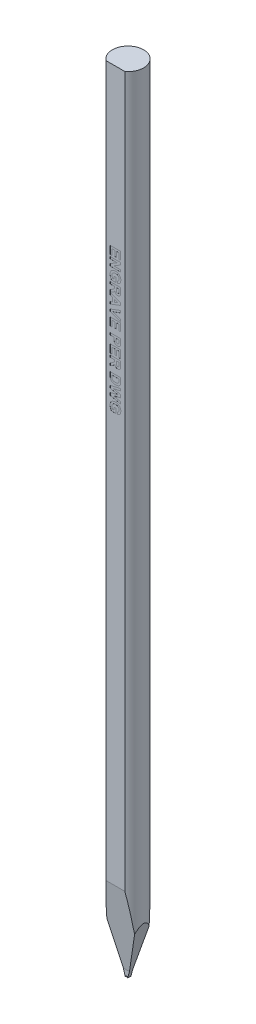
from build123d import *

# Parameters (mm, degrees)
SKETCH_TL_CUTTING_R       = 1.4986
TL_CUTTING_DEPTH          = 75.9968
SKETCH_TDF_GRINDING_W     = 3.0172
SKETCH_TDF_GRINDING_H     = 3.0172
TDF_GRINDING_DEPTH        = 77.026345527
ENGRAVING_DEPTH           = 0.005
VW_VR_GRINDING_DEPTH      = 1.5086
VW_VR_GRINDING_DEPTH_BACK = 1.5086
ISA_GRINDING_DEPTH        = 1.5086
ISA_GRINDING_DEPTH_BACK   = 1.5086
PRE_FRX_BRX_DEPTH         = 1.5086
PRE_FRX_BRX_DEPTH_BACK    = 1.5086
SKETCH_PRE_FRX_BRX_W      = 1.35874
SKETCH_PRE_FRX_BRX_H      = 0.6096
FR_EDM_R                  = 0.0381
BR_EDM_R                  = 0.0381
FA_BA_GRINDING_DEPTH      = 1.5086
FA_BA_GRINDING_DEPTH_BACK = 1.5086


with BuildPart() as part:
    # sketch_TL_cutting → TL_cutting (new body)
    with BuildSketch(Plane(origin=(0, 0, 0), x_dir=(1, 0, 0), z_dir=(0, 1, 0))):
        Circle(SKETCH_TL_CUTTING_R)
    extrude(amount=TL_CUTTING_DEPTH)

    # sketch_TDF_grinding → TDF_grinding (cut, through all)
    with BuildSketch(Plane(origin=(0, 0, 0), x_dir=(1, 0, 0), z_dir=(0, 1, 0))):
        with Locations((0, -2.71002)):
            Rectangle(SKETCH_TDF_GRINDING_W, SKETCH_TDF_GRINDING_H)
    extrude(amount=TDF_GRINDING_DEPTH, mode=Mode.SUBTRACT)

    # sketch_engraving → engraving (cut)
    # profile 1 of 13: a face of its own
    with BuildSketch(Plane.XY.offset(1.20142)):
        Polygon((-0.5, 60.894235897), (0.5, 60.894235897), (0.5, 60.150646154), (0.333333333, 60.150646154), (0.333333333, 60.701928205), (0.115384615, 60.701928205), (0.115384615, 60.189107692), (-0.051282051, 60.189107692), (-0.051282051, 60.701928205), (-0.333333333, 60.701928205), (-0.333333333, 60.137825641), (-0.5, 60.137825641), align=None)
    # profile 2 of 13: a face of its own
    with BuildSketch(Plane.XY.offset(1.20142)):
        Polygon((-0.5, 59.971158974), (0.5, 59.971158974), (0.5, 59.7702375), (-0.157451923, 59.368594872), (0.5, 59.368594872), (0.5, 59.176287179), (-0.5, 59.176287179), (-0.5, 59.38341859), (0.147035256, 59.778851282), (-0.5, 59.778851282), align=None)
    # profile 3 of 13: a face of its own
    with BuildSketch(Plane.XY.offset(1.20142)):
        with BuildLine():
            Line((-0.128205128, 58.522441026), (0.038461538, 58.522441026))
            Line((0.038461538, 58.522441026), (0.038461538, 58.08654359))
            Line((0.038461538, 58.08654359), (-0.36338141, 58.08654359))
            add(Edge.make_bspline(
                [(-0.36338141, 58.08654359), (-0.368321434, 58.092029605), (-0.378419843, 58.103244131), (-0.392661125, 58.121541895), (-0.406257259, 58.14168601), (-0.4194836, 58.1635547), (-0.432233696, 58.187193223), (-0.444685123, 58.212507295), (-0.45671611, 58.239543622), (-0.471787381, 58.277776941), (-0.488186169, 58.326991061), (-0.502445448, 58.387156306), (-0.511191227, 58.447797498), (-0.512277771, 58.488358306), (-0.512820513, 58.50861891)],
                knots=[0, 0, 0, 0, 0.581799769, 1.189316438, 1.825828404, 2.496525428, 3.203088405, 3.942228803, 4.719818701, 5.534979611, 7.181138583, 8.803804008, 10.403462225, 12, 12, 12, 12], degree=3))
            add(Edge.make_bspline(
                [(-0.512820513, 58.50861891), (-0.512629241, 58.521311396), (-0.512252188, 58.546332062), (-0.509233571, 58.583270349), (-0.504017902, 58.618987455), (-0.496780719, 58.653419967), (-0.487836372, 58.686670877), (-0.476607913, 58.718623396), (-0.463065488, 58.749243299), (-0.447986133, 58.778759812), (-0.430657849, 58.806612408), (-0.411724289, 58.832856254), (-0.390891397, 58.857236635), (-0.36853351, 58.879965448), (-0.344060025, 58.900614033), (-0.318106216, 58.919695872), (-0.290219674, 58.936754268), (-0.260879177, 58.95208079), (-0.230317098, 58.965710173), (-0.198781008, 58.977212477), (-0.166726875, 58.987296153), (-0.134042675, 58.995583938), (-0.10062201, 59.001670885), (-0.066619552, 59.00640276), (-0.031822841, 59.008944234), (-0.008417054, 59.009393556), (0.003405449, 59.009620513)],
                knots=[0, 0, 0, 0, 1.124897971, 2.217508473, 3.282174662, 4.322209414, 5.334422951, 6.332119154, 7.320662553, 8.300074908, 9.267468154, 10.225199689, 11.165658754, 12.107290334, 13.047749399, 14.00069605, 14.959944213, 15.942088746, 16.933021067, 17.923599838, 18.915715637, 19.910475908, 20.909926025, 21.925232038, 22.952013513, 24, 24, 24, 24], degree=3))
            add(Edge.make_bspline(
                [(0.003405449, 59.009620513), (0.016165747, 59.009436614), (0.041321811, 59.009074069), (0.078501182, 59.005944425), (0.114594914, 59.00109647), (0.149519517, 58.993701478), (0.183523729, 58.984848027), (0.216299841, 58.973503339), (0.248180515, 58.960549892), (0.278688999, 58.945265774), (0.308028284, 58.928383202), (0.335510174, 58.909199631), (0.361403632, 58.88838003), (0.385591047, 58.865737199), (0.407627145, 58.840898237), (0.428063784, 58.814372539), (0.447146094, 58.78617769), (0.457908016, 58.766000967), (0.463341346, 58.755814423)],
                knots=[0, 0, 0, 0, 1.105132952, 2.178694671, 3.229818344, 4.257558797, 5.269123684, 6.27148554, 7.259679084, 8.247804916, 9.224967877, 10.189258471, 11.147685264, 12.101072275, 13.055511435, 14.02039165, 15.000562851, 16, 16, 16, 16], degree=3))
            add(Edge.make_bspline(
                [(0.463341346, 58.755814423), (0.467347168, 58.747727072), (0.475455657, 58.731356849), (0.485329628, 58.705283756), (0.494054347, 58.677916179), (0.500719187, 58.648934703), (0.506115234, 58.618648224), (0.510216979, 58.586907147), (0.512307439, 58.553652939), (0.512647258, 58.530990515), (0.512820513, 58.519436218)],
                knots=[0, 0, 0, 0, 0.887950456, 1.797368171, 2.741221183, 3.713797788, 4.722103116, 5.768966405, 6.862521341, 8, 8, 8, 8], degree=3))
            add(Edge.make_bspline(
                [(0.512820513, 58.519436218), (0.512598613, 58.504538718), (0.512167059, 58.475565835), (0.508571106, 58.433325541), (0.502373597, 58.393571904), (0.493837942, 58.356249565), (0.482863355, 58.321438928), (0.469371425, 58.289199918), (0.453633675, 58.25933466), (0.435019378, 58.232275716), (0.414494937, 58.207473149), (0.392035387, 58.18499168), (0.367607461, 58.164822262), (0.341334074, 58.146951549), (0.313106625, 58.131520198), (0.283182558, 58.118252182), (0.251334696, 58.107331), (0.22921692, 58.102053034), (0.217948718, 58.099364103)],
                knots=[0, 0, 0, 0, 1.271135529, 2.472123572, 3.614091059, 4.701890498, 5.736279567, 6.724681829, 7.680621489, 8.611506429, 9.52200816, 10.424540711, 11.318996785, 12.221421405, 13.131851814, 14.060431888, 15.011860567, 16, 16, 16, 16], degree=3))
            Line((0.217948718, 58.099364103), (0.179487179, 58.291671795))
            add(Edge.make_bspline(
                [(0.179487179, 58.291671795), (0.185798707, 58.293574377), (0.198251232, 58.297328136), (0.216108293, 58.304634712), (0.232994438, 58.312952834), (0.248643132, 58.322779827), (0.263649233, 58.333217482), (0.277161531, 58.345487665), (0.290187329, 58.358394684), (0.301701762, 58.37288584), (0.312086782, 58.388324395), (0.321450083, 58.404545863), (0.329043783, 58.421914205), (0.335153652, 58.440186828), (0.340342569, 58.459274233), (0.343533767, 58.479425571), (0.345940549, 58.50041453), (0.346081986, 58.514754556), (0.346153846, 58.522040385)],
                knots=[0, 0, 0, 0, 1.027780279, 2.027791312, 3.006028774, 3.96000864, 4.908113241, 5.852721087, 6.802883308, 7.765918715, 8.733730415, 9.704005314, 10.683351261, 11.68471758, 12.707948499, 13.764514378, 14.864202456, 16, 16, 16, 16], degree=3))
            add(Edge.make_bspline(
                [(0.346153846, 58.522040385), (0.345859633, 58.533067741), (0.34528545, 58.554588568), (0.341538784, 58.586006107), (0.334873123, 58.615645672), (0.325679114, 58.64358477), (0.313877959, 58.669874621), (0.299029501, 58.694159968), (0.282012344, 58.717045501), (0.262039987, 58.737879978), (0.239645267, 58.756774481), (0.214561065, 58.773131053), (0.186868462, 58.78674783), (0.156706511, 58.797900746), (0.124073954, 58.806780847), (0.088855272, 58.812804995), (0.051104495, 58.816741063), (0.02505068, 58.817118323), (0.01161859, 58.817312821)],
                knots=[0, 0, 0, 0, 1.043810997, 2.037086103, 2.989314757, 3.91471467, 4.817033861, 5.710208705, 6.603920097, 7.511448416, 8.435617211, 9.371747005, 10.338444094, 11.350425613, 12.411431869, 13.5347293, 14.729025275, 16, 16, 16, 16], degree=3))
            add(Edge.make_bspline(
                [(0.01161859, 58.817312821), (-0.002813331, 58.817110147), (-0.03086261, 58.816716238), (-0.071503034, 58.812881337), (-0.109371212, 58.806583116), (-0.14440027, 58.797515757), (-0.176807311, 58.786208494), (-0.206438048, 58.772228966), (-0.233109204, 58.75542113), (-0.256980675, 58.736358295), (-0.278169336, 58.715321484), (-0.296147735, 58.692258524), (-0.31184176, 58.668000317), (-0.32420794, 58.641860517), (-0.33413508, 58.614312028), (-0.341078682, 58.585085999), (-0.345395871, 58.554287729), (-0.345897627, 58.533206176), (-0.346153846, 58.522441026)],
                knots=[0, 0, 0, 0, 1.31821493, 2.562027667, 3.72541598, 4.821825939, 5.863743127, 6.857000185, 7.808227391, 8.737146514, 9.643023621, 10.529087527, 11.404035307, 12.277173472, 13.164790074, 14.074766194, 15.016892606, 16, 16, 16, 16], degree=3))
            add(Edge.make_bspline(
                [(-0.346153846, 58.522441026), (-0.345850315, 58.511537735), (-0.34524035, 58.489626847), (-0.340086045, 58.456805767), (-0.332449955, 58.423805514), (-0.321065283, 58.391413163), (-0.307937779, 58.360026456), (-0.292687307, 58.330860255), (-0.276962331, 58.303467677), (-0.264654274, 58.2869552), (-0.258613782, 58.278851282)],
                knots=[0, 0, 0, 0, 0.993779204, 1.997065276, 3.023588959, 4.078879359, 5.123947549, 6.123456565, 7.079038607, 8, 8, 8, 8], degree=3))
            Line((-0.258613782, 58.278851282), (-0.128205128, 58.278851282))
            Line((-0.128205128, 58.278851282), (-0.128205128, 58.522441026))
        make_face()
    # profile 4 of 13: a face of its own
    with BuildSketch(Plane.XY.offset(1.20142)):
        with BuildLine():
            Line((-0.5, 57.894235897), (0.5, 57.894235897))
            Line((0.5, 57.894235897), (0.5, 57.474564423))
            add(Edge.make_bspline(
                [(0.5, 57.474564423), (0.499921351, 57.461810201), (0.499769781, 57.437230481), (0.498665723, 57.401683268), (0.496349389, 57.368901265), (0.493735057, 57.338736822), (0.489890849, 57.311277094), (0.485377151, 57.286456079), (0.480042652, 57.264353829), (0.473762142, 57.2447266), (0.46640441, 57.226899938), (0.457825047, 57.210235326), (0.447696774, 57.194575272), (0.436444977, 57.179714477), (0.424039539, 57.165595254), (0.410155618, 57.152603274), (0.394999014, 57.140512567), (0.378696089, 57.129332781), (0.361318758, 57.119484096), (0.343425117, 57.110484982), (0.324824746, 57.103159364), (0.305605269, 57.09710847), (0.285808412, 57.092274923), (0.265383845, 57.088920032), (0.244368538, 57.086825611), (0.230173307, 57.086638641), (0.222956731, 57.08654359)],
                knots=[0, 0, 0, 0, 1.675792322, 3.229558513, 4.671612708, 5.993327294, 7.206773438, 8.313218507, 9.306927966, 10.191988363, 11.018030861, 11.838135071, 12.650980327, 13.465150207, 14.285535933, 15.117196726, 15.959844754, 16.83101188, 17.711363548, 18.582398133, 19.460517458, 20.334551361, 21.228266118, 22.135486512, 23.052118027, 24, 24, 24, 24], degree=3))
            add(Edge.make_bspline(
                [(0.222956731, 57.08654359), (0.213865176, 57.08671771), (0.196097772, 57.087057988), (0.170067915, 57.090259374), (0.145135532, 57.094860931), (0.121515047, 57.101974247), (0.099028777, 57.110818829), (0.077834712, 57.121624821), (0.057734109, 57.134377691), (0.039011166, 57.149143067), (0.021628172, 57.165861702), (0.005964946, 57.184627919), (-0.008142217, 57.205317705), (-0.020271369, 57.228100383), (-0.030960543, 57.252583224), (-0.039742833, 57.279088699), (-0.046961528, 57.30748005), (-0.050349413, 57.327234525), (-0.052083333, 57.337344872)],
                knots=[0, 0, 0, 0, 1.059179627, 2.069928931, 3.052909591, 4.01082991, 4.940120368, 5.865982481, 6.779263376, 7.710344595, 8.640547144, 9.585223395, 10.554458868, 11.553878165, 12.589111246, 13.664634927, 14.804759383, 16, 16, 16, 16], degree=3))
            add(Edge.make_bspline(
                [(-0.052083333, 57.337344872), (-0.058543192, 57.327554557), (-0.071157156, 57.308437315), (-0.092244136, 57.282140986), (-0.113935974, 57.258182324), (-0.13350323, 57.240195798), (-0.150629326, 57.226361316), (-0.165615492, 57.215228495), (-0.182859981, 57.203217912), (-0.202374991, 57.19044991), (-0.22398696, 57.176546224), (-0.248026974, 57.162024206), (-0.274260457, 57.146579885), (-0.292585876, 57.136196031), (-0.302083333, 57.130814423)],
                knots=[0, 0, 0, 0, 1.285482994, 2.510122655, 3.691653098, 4.826411195, 5.419869803, 6.105175889, 6.872935239, 7.723789235, 8.662129684, 9.690525463, 10.803075916, 12, 12, 12, 12], degree=3))
            Line((-0.302083333, 57.130814423), (-0.5, 57.009620513))
            Line((-0.5, 57.009620513), (-0.5, 57.234380128))
            Line((-0.5, 57.234380128), (-0.273036859, 57.376607692))
            add(Edge.make_bspline(
                [(-0.273036859, 57.376607692), (-0.263945443, 57.383137401), (-0.24658806, 57.395603957), (-0.221949287, 57.41363509), (-0.199893124, 57.430036608), (-0.1805544, 57.444827372), (-0.163731826, 57.457827709), (-0.149845803, 57.469482343), (-0.138230202, 57.479219639), (-0.126725879, 57.490254127), (-0.114887633, 57.503080533), (-0.103494307, 57.518942305), (-0.094238036, 57.535123543), (-0.087286311, 57.55262809), (-0.082478883, 57.572919627), (-0.079343719, 57.597279092), (-0.077067211, 57.626432144), (-0.076973557, 57.647502303), (-0.076923077, 57.658859295)],
                knots=[0, 0, 0, 0, 1.465382114, 2.797715724, 3.99708711, 5.063614826, 5.985194575, 6.779875669, 7.43696127, 7.968700361, 8.866038685, 9.717629234, 10.520014012, 11.30082289, 12.174340694, 13.242479345, 14.513673363, 16, 16, 16, 16], degree=3))
            Line((-0.076923077, 57.658859295), (-0.076923077, 57.701928205))
            Line((-0.076923077, 57.701928205), (-0.5, 57.701928205))
            Line((-0.5, 57.701928205), (-0.5, 57.894235897))
        make_face()
        with BuildLine():
            Line((0.08974359, 57.701928205), (0.08974359, 57.547080449))
            add(Edge.make_bspline(
                [(0.08974359, 57.547080449), (0.089768957, 57.5351274), (0.089817287, 57.512354821), (0.090527354, 57.479971991), (0.091115821, 57.451109113), (0.09265079, 57.425809153), (0.094114881, 57.404019334), (0.096069001, 57.385767128), (0.09836301, 57.371028848), (0.101931469, 57.356307986), (0.108148092, 57.341228202), (0.117003495, 57.325158518), (0.128487921, 57.311415466), (0.141777239, 57.299542986), (0.157332372, 57.290378485), (0.174706183, 57.283657484), (0.193862841, 57.279643774), (0.20724563, 57.279120802), (0.214142628, 57.278851282)],
                knots=[0, 0, 0, 0, 1.698120923, 3.235207303, 4.601799022, 5.7989489, 6.835765357, 7.704239165, 8.40605236, 8.953649664, 9.852072573, 10.714567413, 11.550246753, 12.383769498, 13.234656382, 14.099651817, 15.020630301, 16, 16, 16, 16], degree=3))
            add(Edge.make_bspline(
                [(0.214142628, 57.278851282), (0.221852989, 57.27918604), (0.236728888, 57.2798319), (0.257822961, 57.285086949), (0.27662771, 57.293834428), (0.292813882, 57.306323618), (0.306623576, 57.32192236), (0.317392842, 57.340646681), (0.325576055, 57.362091747), (0.328565774, 57.377545804), (0.330128205, 57.385622115)],
                knots=[0, 0, 0, 0, 1.062451802, 2.049829439, 2.976851779, 3.903462222, 4.849641532, 5.832195941, 6.867102576, 8, 8, 8, 8], degree=3))
            add(Edge.make_bspline(
                [(0.330128205, 57.385622115), (0.330421459, 57.388291011), (0.331116534, 57.394616853), (0.331562949, 57.405787541), (0.332249138, 57.420070698), (0.332529569, 57.437639208), (0.333021138, 57.458336115), (0.333111403, 57.482243719), (0.333399792, 57.509286063), (0.333356297, 57.528383752), (0.333333333, 57.538466667)],
                knots=[0, 0, 0, 0, 0.42127143, 0.998501726, 1.753681744, 2.66564073, 3.755712164, 5.002818897, 6.417592707, 8, 8, 8, 8], degree=3))
            Line((0.333333333, 57.538466667), (0.333333333, 57.701928205))
            Line((0.333333333, 57.701928205), (0.08974359, 57.701928205))
        make_face(mode=Mode.SUBTRACT)
    # profile 5 of 13: a face of its own
    with BuildSketch(Plane.XY.offset(1.20142)):
        Polygon((-0.5, 56.035261538), (-0.5, 56.239187821), (-0.269230769, 56.323522756), (-0.269230769, 56.707336859), (-0.5, 56.791671795), (-0.5, 56.9968), (0.5, 56.618795192), (0.5, 56.415069231), align=None)
        Polygon((-0.102564103, 56.384620513), (0.256410256, 56.516030769), (-0.102564103, 56.647040385), align=None, mode=Mode.SUBTRACT)
    # profile 6 of 13: a face of its own
    with BuildSketch(Plane.XY.offset(1.20142)):
        Polygon((-0.5, 55.627008333), (0.5, 55.9968), (0.5, 55.793675), (-0.243589744, 55.528851282), (0.5, 55.265029167), (0.5, 55.060902564), (-0.5, 55.429291987), align=None)
    # profile 7 of 13: a face of its own
    with BuildSketch(Plane.XY.offset(1.20142)):
        Polygon((-0.5, 54.971158974), (0.5, 54.971158974), (0.5, 54.227569231), (0.333333333, 54.227569231), (0.333333333, 54.778851282), (0.115384615, 54.778851282), (0.115384615, 54.266030769), (-0.051282051, 54.266030769), (-0.051282051, 54.778851282), (-0.333333333, 54.778851282), (-0.333333333, 54.214748718), (-0.5, 54.214748718), align=None)
    # profile 8 of 13: a face of its own
    with BuildSketch(Plane.XY.offset(1.20142)):
        with BuildLine():
            Line((-0.5, 53.663466667), (0.5, 53.663466667))
            Line((0.5, 53.663466667), (0.5, 53.343554808))
            add(Edge.make_bspline(
                [(0.5, 53.343554808), (0.4999852, 53.329064455), (0.499956962, 53.301416693), (0.499104777, 53.261884062), (0.497929464, 53.226289855), (0.496434625, 53.194622803), (0.494248137, 53.166966334), (0.491629455, 53.143258956), (0.488933209, 53.123391744), (0.486060508, 53.111634128), (0.484775641, 53.106375321)],
                knots=[0, 0, 0, 0, 1.460492613, 2.786636817, 3.985312262, 5.05006335, 5.98179196, 6.7807735, 7.454678796, 8, 8, 8, 8], degree=3))
            add(Edge.make_bspline(
                [(0.484775641, 53.106375321), (0.482781564, 53.099381959), (0.478823789, 53.085501776), (0.470386441, 53.065615803), (0.460608006, 53.04644887), (0.448953875, 53.028241805), (0.435630967, 53.010932663), (0.420747869, 52.994470188), (0.404237636, 52.978765844), (0.386131953, 52.964039765), (0.366525691, 52.950543742), (0.345376234, 52.938912401), (0.322847402, 52.929051925), (0.298873329, 52.921127517), (0.273610941, 52.914575617), (0.246834559, 52.910393024), (0.218752408, 52.907369504), (0.199528035, 52.9071623), (0.189703526, 52.90705641)],
                knots=[0, 0, 0, 0, 0.907183394, 1.800546498, 2.691728384, 3.591410291, 4.495216108, 5.416087871, 6.359626967, 7.337496937, 8.327236581, 9.327316132, 10.346534403, 11.393207653, 12.477041209, 13.600953845, 14.773980723, 16, 16, 16, 16], degree=3))
            add(Edge.make_bspline(
                [(0.189703526, 52.90705641), (0.174784734, 52.907364918), (0.146065241, 52.907958813), (0.104894137, 52.914608263), (0.067280604, 52.924741168), (0.03361575, 52.939582122), (0.003633111, 52.957595209), (-0.023091697, 52.977763014), (-0.046492635, 53.000246245), (-0.066210989, 53.024825478), (-0.082434, 53.050756803), (-0.096247437, 53.076755341), (-0.106871469, 53.103146515), (-0.11149992, 53.12114078), (-0.113782051, 53.130013141)],
                knots=[0, 0, 0, 0, 1.312446177, 2.526530956, 3.662051072, 4.733637382, 5.754065268, 6.735959421, 7.675686778, 8.604015004, 9.502732733, 10.365317746, 11.193993632, 12, 12, 12, 12], degree=3))
            add(Edge.make_bspline(
                [(-0.113782051, 53.130013141), (-0.114986663, 53.136345752), (-0.11752584, 53.149694139), (-0.120056937, 53.170863883), (-0.122858586, 53.194003561), (-0.124685978, 53.219208347), (-0.126397255, 53.24644775), (-0.127205205, 53.275711194), (-0.128178621, 53.306956857), (-0.128196112, 53.328463031), (-0.128205128, 53.339548397)],
                knots=[0, 0, 0, 0, 0.735353946, 1.55003838, 2.431865514, 3.394945452, 4.432993119, 5.54609699, 6.735134699, 8, 8, 8, 8], degree=3))
            Line((-0.128205128, 53.339548397), (-0.128205128, 53.471158974))
            Line((-0.128205128, 53.471158974), (-0.5, 53.471158974))
            Line((-0.5, 53.471158974), (-0.5, 53.663466667))
        make_face()
        with BuildLine():
            Line((0.333333333, 53.471158974), (0.038461538, 53.471158974))
            Line((0.038461538, 53.471158974), (0.038461538, 53.355774359))
            add(Edge.make_bspline(
                [(0.038461538, 53.355774359), (0.038474423, 53.345824233), (0.038499073, 53.32678839), (0.039383856, 53.299476178), (0.040463899, 53.274753138), (0.04225159, 53.252567611), (0.044607724, 53.233053517), (0.047425958, 53.216080173), (0.050450217, 53.201627797), (0.055461898, 53.18599952), (0.063570342, 53.169289767), (0.075224213, 53.151445715), (0.089157789, 53.135769737), (0.105522293, 53.122725245), (0.123704204, 53.112305583), (0.143517189, 53.104845099), (0.164632877, 53.10002787), (0.179260262, 53.099587861), (0.186698718, 53.099364103)],
                knots=[0, 0, 0, 0, 1.411705958, 2.700771114, 3.876961699, 4.922619712, 5.858038221, 6.66485904, 7.363650596, 7.950905807, 8.989198271, 9.987739806, 10.967313358, 11.951275539, 12.944273208, 13.927870418, 14.946261014, 16, 16, 16, 16], degree=3))
            add(Edge.make_bspline(
                [(0.186698718, 53.099364103), (0.195758642, 53.099679017), (0.213324639, 53.100289596), (0.238341551, 53.10702257), (0.261044702, 53.117410781), (0.280727694, 53.132262972), (0.297279472, 53.15020407), (0.31105114, 53.170369116), (0.320688658, 53.193188742), (0.32442284, 53.209338921), (0.326322115, 53.217553205)],
                knots=[0, 0, 0, 0, 1.085904563, 2.105425768, 3.088705091, 4.068969419, 5.045188284, 6.010769642, 6.988240112, 8, 8, 8, 8], degree=3))
            add(Edge.make_bspline(
                [(0.326322115, 53.217553205), (0.326887477, 53.221087999), (0.328142404, 53.228934146), (0.329452077, 53.241976039), (0.330643223, 53.257404601), (0.331621189, 53.275238428), (0.332385732, 53.295406833), (0.333055661, 53.31797634), (0.333109481, 53.342887507), (0.333256648, 53.36031512), (0.333333333, 53.369396154)],
                knots=[0, 0, 0, 0, 0.564603001, 1.253243608, 2.066786758, 3.005752288, 4.070476343, 5.250658742, 6.567396469, 8, 8, 8, 8], degree=3))
            Line((0.333333333, 53.369396154), (0.333333333, 53.471158974))
        make_face(mode=Mode.SUBTRACT)
    # profile 9 of 13: a face of its own
    with BuildSketch(Plane.XY.offset(1.20142)):
        Polygon((-0.5, 52.740389744), (0.5, 52.740389744), (0.5, 51.9968), (0.333333333, 51.9968), (0.333333333, 52.548082051), (0.115384615, 52.548082051), (0.115384615, 52.035261538), (-0.051282051, 52.035261538), (-0.051282051, 52.548082051), (-0.333333333, 52.548082051), (-0.333333333, 51.983979487), (-0.5, 51.983979487), align=None)
    # profile 10 of 13: a face of its own
    with BuildSketch(Plane.XY.offset(1.20142)):
        with BuildLine():
            Line((-0.5, 51.817312821), (0.5, 51.817312821))
            Line((0.5, 51.817312821), (0.5, 51.397641346))
            add(Edge.make_bspline(
                [(0.5, 51.397641346), (0.499921351, 51.384887124), (0.499769781, 51.360307404), (0.498665723, 51.324760191), (0.496349389, 51.291978188), (0.493735057, 51.261813745), (0.489890849, 51.234354017), (0.485377151, 51.209533002), (0.480042652, 51.187430752), (0.473762142, 51.167803523), (0.46640441, 51.149976861), (0.457825047, 51.133312249), (0.447696774, 51.117652195), (0.436444977, 51.1027914), (0.424039539, 51.088672178), (0.410155618, 51.075680198), (0.394999014, 51.06358949), (0.378696089, 51.052409704), (0.361318758, 51.042561019), (0.343425117, 51.033561905), (0.324824746, 51.026236287), (0.305605269, 51.020185393), (0.285808412, 51.015351846), (0.265383845, 51.011996956), (0.244368538, 51.009902534), (0.230173307, 51.009715564), (0.222956731, 51.009620513)],
                knots=[0, 0, 0, 0, 1.675792322, 3.229558513, 4.671612708, 5.993327294, 7.206773438, 8.313218507, 9.306927966, 10.191988363, 11.018030861, 11.838135071, 12.650980327, 13.465150207, 14.285535933, 15.117196726, 15.959844754, 16.83101188, 17.711363548, 18.582398133, 19.460517458, 20.334551361, 21.228266118, 22.135486512, 23.052118027, 24, 24, 24, 24], degree=3))
            add(Edge.make_bspline(
                [(0.222956731, 51.009620513), (0.213865176, 51.009794633), (0.196097772, 51.010134911), (0.170067915, 51.013336297), (0.145135532, 51.017937854), (0.121515047, 51.02505117), (0.099028777, 51.033895752), (0.077834712, 51.044701744), (0.057734109, 51.057454614), (0.039011166, 51.07221999), (0.021628172, 51.088938625), (0.005964946, 51.107704843), (-0.008142217, 51.128394628), (-0.020271369, 51.151177306), (-0.030960543, 51.175660147), (-0.039742833, 51.202165622), (-0.046961528, 51.230556973), (-0.050349413, 51.250311448), (-0.052083333, 51.260421795)],
                knots=[0, 0, 0, 0, 1.059179627, 2.069928931, 3.052909591, 4.01082991, 4.940120368, 5.865982481, 6.779263376, 7.710344595, 8.640547144, 9.585223395, 10.554458868, 11.553878165, 12.589111246, 13.664634927, 14.804759383, 16, 16, 16, 16], degree=3))
            add(Edge.make_bspline(
                [(-0.052083333, 51.260421795), (-0.058543192, 51.25063148), (-0.071157156, 51.231514238), (-0.092244136, 51.205217909), (-0.113935974, 51.181259247), (-0.13350323, 51.163272722), (-0.150629326, 51.149438239), (-0.165615492, 51.138305418), (-0.182859981, 51.126294835), (-0.202374991, 51.113526833), (-0.22398696, 51.099623147), (-0.248026974, 51.085101129), (-0.274260457, 51.069656808), (-0.292585876, 51.059272954), (-0.302083333, 51.053891346)],
                knots=[0, 0, 0, 0, 1.285482994, 2.510122655, 3.691653098, 4.826411195, 5.419869803, 6.105175889, 6.872935239, 7.723789235, 8.662129684, 9.690525463, 10.803075916, 12, 12, 12, 12], degree=3))
            Line((-0.302083333, 51.053891346), (-0.5, 50.932697436))
            Line((-0.5, 50.932697436), (-0.5, 51.157457051))
            Line((-0.5, 51.157457051), (-0.273036859, 51.299684615))
            add(Edge.make_bspline(
                [(-0.273036859, 51.299684615), (-0.263945443, 51.306214324), (-0.24658806, 51.31868088), (-0.221949287, 51.336712013), (-0.199893124, 51.353113531), (-0.1805544, 51.367904295), (-0.163731826, 51.380904632), (-0.149845803, 51.392559266), (-0.138230202, 51.402296562), (-0.126725879, 51.41333105), (-0.114887633, 51.426157456), (-0.103494307, 51.442019228), (-0.094238036, 51.458200466), (-0.087286311, 51.475705013), (-0.082478883, 51.495996551), (-0.079343719, 51.520356015), (-0.077067211, 51.549509067), (-0.076973557, 51.570579226), (-0.076923077, 51.581936218)],
                knots=[0, 0, 0, 0, 1.465382114, 2.797715724, 3.99708711, 5.063614826, 5.985194575, 6.779875669, 7.43696127, 7.968700361, 8.866038685, 9.717629234, 10.520014012, 11.30082289, 12.174340694, 13.242479345, 14.513673363, 16, 16, 16, 16], degree=3))
            Line((-0.076923077, 51.581936218), (-0.076923077, 51.625005128))
            Line((-0.076923077, 51.625005128), (-0.5, 51.625005128))
            Line((-0.5, 51.625005128), (-0.5, 51.817312821))
        make_face()
        with BuildLine():
            Line((0.08974359, 51.625005128), (0.08974359, 51.470157372))
            add(Edge.make_bspline(
                [(0.08974359, 51.470157372), (0.089768957, 51.458204323), (0.089817287, 51.435431744), (0.090527354, 51.403048914), (0.091115821, 51.374186036), (0.09265079, 51.348886076), (0.094114881, 51.327096257), (0.096069001, 51.308844051), (0.09836301, 51.294105771), (0.101931469, 51.279384909), (0.108148092, 51.264305125), (0.117003495, 51.248235441), (0.128487921, 51.234492389), (0.141777239, 51.222619909), (0.157332372, 51.213455408), (0.174706183, 51.206734407), (0.193862841, 51.202720697), (0.20724563, 51.202197726), (0.214142628, 51.201928205)],
                knots=[0, 0, 0, 0, 1.698120923, 3.235207303, 4.601799022, 5.7989489, 6.835765357, 7.704239165, 8.40605236, 8.953649664, 9.852072573, 10.714567413, 11.550246753, 12.383769498, 13.234656382, 14.099651817, 15.020630301, 16, 16, 16, 16], degree=3))
            add(Edge.make_bspline(
                [(0.214142628, 51.201928205), (0.221852989, 51.202262963), (0.236728888, 51.202908823), (0.257822961, 51.208163872), (0.27662771, 51.216911351), (0.292813882, 51.229400541), (0.306623576, 51.244999283), (0.317392842, 51.263723604), (0.325576055, 51.28516867), (0.328565774, 51.300622727), (0.330128205, 51.308699038)],
                knots=[0, 0, 0, 0, 1.062451802, 2.049829439, 2.976851779, 3.903462222, 4.849641532, 5.832195941, 6.867102576, 8, 8, 8, 8], degree=3))
            add(Edge.make_bspline(
                [(0.330128205, 51.308699038), (0.330421459, 51.311367934), (0.331116534, 51.317693776), (0.331562949, 51.328864464), (0.332249138, 51.343147621), (0.332529569, 51.360716131), (0.333021138, 51.381413038), (0.333111403, 51.405320642), (0.333399792, 51.432362986), (0.333356297, 51.451460675), (0.333333333, 51.46154359)],
                knots=[0, 0, 0, 0, 0.42127143, 0.998501726, 1.753681744, 2.66564073, 3.755712164, 5.002818897, 6.417592707, 8, 8, 8, 8], degree=3))
            Line((0.333333333, 51.46154359), (0.333333333, 51.625005128))
            Line((0.333333333, 51.625005128), (0.08974359, 51.625005128))
        make_face(mode=Mode.SUBTRACT)
    # profile 11 of 13: a face of its own
    with BuildSketch(Plane.XY.offset(1.20142)):
        with BuildLine():
            Line((0.5, 50.432697436), (0.5, 50.065910577))
            add(Edge.make_bspline(
                [(0.5, 50.065910577), (0.500005193, 50.055893032), (0.500015306, 50.036386546), (0.498840892, 50.008077527), (0.497659587, 49.981604956), (0.495294873, 49.957044813), (0.492816233, 49.934311894), (0.489678088, 49.913365404), (0.485656212, 49.894337663), (0.482484481, 49.882338781), (0.480969551, 49.876607692)],
                knots=[0, 0, 0, 0, 1.259756885, 2.453039283, 3.563158368, 4.591894114, 5.55549294, 6.43918076, 7.254497783, 8, 8, 8, 8], degree=3))
            add(Edge.make_bspline(
                [(0.480969551, 49.876607692), (0.478637325, 49.869438716), (0.474014881, 49.855229893), (0.465827813, 49.83437684), (0.455960096, 49.814542941), (0.445111978, 49.79526828), (0.432903728, 49.776996015), (0.419595761, 49.759281335), (0.404753223, 49.742648264), (0.383633179, 49.721113601), (0.35420815, 49.696688717), (0.315375005, 49.670858181), (0.272594656, 49.649120476), (0.234409605, 49.633929103), (0.20183843, 49.623885004), (0.175754603, 49.617316602), (0.148301213, 49.611644929), (0.119383738, 49.607394754), (0.08913491, 49.603733367), (0.057465542, 49.601105699), (0.024383276, 49.599804712), (0.001870575, 49.599512956), (-0.009615385, 49.599364103)],
                knots=[0, 0, 0, 0, 0.745431882, 1.477436776, 2.212739876, 2.934276521, 3.663147754, 4.384200836, 5.123377481, 5.865761747, 7.365547505, 8.894711587, 10.468722596, 12.101948761, 12.951987285, 13.837595333, 14.760899389, 15.722756883, 16.726861385, 17.773652936, 18.864119771, 20, 20, 20, 20], degree=3))
            add(Edge.make_bspline(
                [(-0.009615385, 49.599364103), (-0.0294616, 49.599755507), (-0.067834928, 49.600512302), (-0.123301552, 49.606109673), (-0.17465514, 49.61540511), (-0.206804138, 49.625115536), (-0.222355769, 49.629812821)],
                knots=[0, 0, 0, 0, 1.103491527, 2.133638164, 3.0971734, 4, 4, 4, 4], degree=3))
            add(Edge.make_bspline(
                [(-0.222355769, 49.629812821), (-0.231274521, 49.632986465), (-0.248819098, 49.639229518), (-0.274127236, 49.650154394), (-0.298211673, 49.661958799), (-0.321053432, 49.674740646), (-0.342549771, 49.688564513), (-0.362636394, 49.703482107), (-0.381577746, 49.719262192), (-0.393236239, 49.730693951), (-0.399038462, 49.736383333)],
                knots=[0, 0, 0, 0, 1.090884612, 2.145940218, 3.175104604, 4.181306866, 5.161203701, 6.118658341, 7.063689906, 8, 8, 8, 8], degree=3))
            add(Edge.make_bspline(
                [(-0.399038462, 49.736383333), (-0.407300305, 49.745669607), (-0.424264154, 49.764736893), (-0.445652736, 49.798088411), (-0.464086504, 49.835963738), (-0.473760833, 49.863277629), (-0.478766026, 49.877408974)],
                knots=[0, 0, 0, 0, 0.912008655, 1.872605891, 2.89935344, 4, 4, 4, 4], degree=3))
            add(Edge.make_bspline(
                [(-0.478766026, 49.877408974), (-0.4805228, 49.883128948), (-0.484168894, 49.895000457), (-0.488062998, 49.913823906), (-0.492165475, 49.933918409), (-0.49463687, 49.955515685), (-0.497243066, 49.978391543), (-0.498706299, 50.002728283), (-0.49974511, 50.028441542), (-0.499913777, 50.046077636), (-0.5, 50.055093269)],
                knots=[0, 0, 0, 0, 0.799129865, 1.658552685, 2.566799617, 3.538529252, 4.561352959, 5.643373779, 6.795284424, 8, 8, 8, 8], degree=3))
            Line((-0.5, 50.055093269), (-0.5, 50.432697436))
            Line((-0.5, 50.432697436), (0.5, 50.432697436))
        make_face()
        with BuildLine():
            Line((0.333333333, 50.240389744), (-0.333333333, 50.240389744))
            Line((-0.333333333, 50.240389744), (-0.333333333, 50.082136538))
            add(Edge.make_bspline(
                [(-0.333333333, 50.082136538), (-0.333276671, 50.074991821), (-0.333167574, 50.061235511), (-0.332847006, 50.041329778), (-0.331979167, 50.023036576), (-0.331080228, 50.006260076), (-0.329595022, 49.991043952), (-0.328134266, 49.977321997), (-0.326090699, 49.965170593), (-0.324477534, 49.957665588), (-0.323717949, 49.954131731)],
                knots=[0, 0, 0, 0, 1.333384787, 2.567275092, 3.714769766, 4.750907381, 5.701951617, 6.567520054, 7.325492842, 8, 8, 8, 8], degree=3))
            add(Edge.make_bspline(
                [(-0.323717949, 49.954131731), (-0.321509316, 49.945855036), (-0.317207482, 49.929734219), (-0.307617456, 49.907098961), (-0.296048139, 49.886616969), (-0.282136533, 49.867945232), (-0.26455548, 49.851118131), (-0.242070693, 49.836754145), (-0.215254411, 49.823460653), (-0.189584523, 49.814357267), (-0.16665678, 49.807822874), (-0.147412959, 49.803399626), (-0.126593091, 49.799904053), (-0.104279343, 49.796897404), (-0.080500412, 49.79446796), (-0.055170426, 49.792956245), (-0.028320392, 49.79192449), (-0.009883527, 49.791757622), (-0.000400641, 49.791671795)],
                knots=[0, 0, 0, 0, 1.038686998, 2.023088296, 2.974059649, 3.888265163, 4.839857954, 5.909819677, 7.113156087, 8.466843969, 9.20827164, 10.006482943, 10.861893492, 11.769681931, 12.739021491, 13.762258324, 14.849031541, 16, 16, 16, 16], degree=3))
            add(Edge.make_bspline(
                [(-0.000400641, 49.791671795), (0.009082275, 49.791756962), (0.027452469, 49.791921946), (0.054102292, 49.792952126), (0.079033415, 49.794455325), (0.102276578, 49.796902152), (0.123864169, 49.799861918), (0.143813574, 49.803399353), (0.161996804, 49.807792884), (0.183589283, 49.814345973), (0.207947697, 49.824183458), (0.23429421, 49.838009661), (0.2571147, 49.854274863), (0.276689574, 49.872630019), (0.29287817, 49.893717031), (0.306422028, 49.917087832), (0.316938162, 49.943218741), (0.321416742, 49.961807779), (0.323717949, 49.971359295)],
                knots=[0, 0, 0, 0, 1.118059345, 2.165891593, 3.144157881, 4.062285166, 4.920717571, 5.712910489, 6.449981617, 7.12489426, 8.371943983, 9.541298068, 10.624898781, 11.666293176, 12.69306237, 13.747704633, 14.842713931, 16, 16, 16, 16], degree=3))
            add(Edge.make_bspline(
                [(0.323717949, 49.971359295), (0.324486218, 49.975493605), (0.326177652, 49.984595773), (0.328151987, 49.999700032), (0.329628909, 50.01748664), (0.331099472, 50.037915577), (0.331977905, 50.060965526), (0.332859431, 50.086671032), (0.333166326, 50.115055313), (0.333276065, 50.134887669), (0.333333333, 50.1452375)],
                knots=[0, 0, 0, 0, 0.578739524, 1.274162912, 2.095457587, 3.035141998, 4.093102578, 5.270121571, 6.575369351, 8, 8, 8, 8], degree=3))
            Line((0.333333333, 50.1452375), (0.333333333, 50.240389744))
        make_face(mode=Mode.SUBTRACT)
    # profile 12 of 13: a face of its own
    with BuildSketch(Plane.XY.offset(1.20142)):
        Polygon((-0.5, 49.295878526), (0.5, 49.535261538), (0.5, 49.338146154), (-0.186899038, 49.182697436), (0.5, 49.018234295), (0.5, 48.755814423), (-0.198517628, 48.592953846), (0.5, 48.437905769), (0.5, 48.240389744), (-0.5, 48.475365705), (-0.5, 48.713546795), (0.247596154, 48.887825641), (-0.5, 49.066711859), align=None)
    # profile 13 of 13: a face of its own
    with BuildSketch(Plane.XY.offset(1.20142)):
        with BuildLine():
            Line((-0.128205128, 47.676287179), (0.038461538, 47.676287179))
            Line((0.038461538, 47.676287179), (0.038461538, 47.240389744))
            Line((0.038461538, 47.240389744), (-0.36338141, 47.240389744))
            add(Edge.make_bspline(
                [(-0.36338141, 47.240389744), (-0.368321434, 47.245875759), (-0.378419843, 47.257090285), (-0.392661125, 47.275388049), (-0.406257259, 47.295532164), (-0.4194836, 47.317400854), (-0.432233696, 47.341039376), (-0.444685123, 47.366353449), (-0.45671611, 47.393389776), (-0.471787381, 47.431623095), (-0.488186169, 47.480837215), (-0.502445448, 47.54100246), (-0.511191227, 47.601643651), (-0.512277771, 47.64220446), (-0.512820513, 47.662465064)],
                knots=[0, 0, 0, 0, 0.581799769, 1.189316438, 1.825828404, 2.496525428, 3.203088405, 3.942228803, 4.719818701, 5.534979611, 7.181138583, 8.803804008, 10.403462225, 12, 12, 12, 12], degree=3))
            add(Edge.make_bspline(
                [(-0.512820513, 47.662465064), (-0.512629241, 47.67515755), (-0.512252188, 47.700178215), (-0.509233571, 47.737116503), (-0.504017902, 47.772833609), (-0.496780719, 47.807266121), (-0.487836372, 47.84051703), (-0.476607913, 47.87246955), (-0.463065488, 47.903089453), (-0.447986133, 47.932605966), (-0.430657849, 47.960458562), (-0.411724289, 47.986702408), (-0.390891397, 48.011082789), (-0.36853351, 48.033811601), (-0.344060025, 48.054460187), (-0.318106216, 48.073542026), (-0.290219674, 48.090600422), (-0.260879177, 48.105926944), (-0.230317098, 48.119556327), (-0.198781008, 48.13105863), (-0.166726875, 48.141142307), (-0.134042675, 48.149430092), (-0.10062201, 48.155517039), (-0.066619552, 48.160248914), (-0.031822841, 48.162790388), (-0.008417054, 48.16323971), (0.003405449, 48.163466667)],
                knots=[0, 0, 0, 0, 1.124897971, 2.217508473, 3.282174662, 4.322209414, 5.334422951, 6.332119154, 7.320662553, 8.300074908, 9.267468154, 10.225199689, 11.165658754, 12.107290334, 13.047749399, 14.00069605, 14.959944213, 15.942088746, 16.933021067, 17.923599838, 18.915715637, 19.910475908, 20.909926025, 21.925232038, 22.952013513, 24, 24, 24, 24], degree=3))
            add(Edge.make_bspline(
                [(0.003405449, 48.163466667), (0.016165747, 48.163282768), (0.041321811, 48.162920223), (0.078501182, 48.159790579), (0.114594914, 48.154942624), (0.149519517, 48.147547632), (0.183523729, 48.13869418), (0.216299841, 48.127349493), (0.248180515, 48.114396046), (0.278688999, 48.099111928), (0.308028284, 48.082229356), (0.335510174, 48.063045784), (0.361403632, 48.042226184), (0.385591047, 48.019583353), (0.407627145, 47.994744391), (0.428063784, 47.968218692), (0.447146094, 47.940023844), (0.457908016, 47.919847121), (0.463341346, 47.909660577)],
                knots=[0, 0, 0, 0, 1.105132952, 2.178694671, 3.229818344, 4.257558797, 5.269123684, 6.27148554, 7.259679084, 8.247804916, 9.224967877, 10.189258471, 11.147685264, 12.101072275, 13.055511435, 14.02039165, 15.000562851, 16, 16, 16, 16], degree=3))
            add(Edge.make_bspline(
                [(0.463341346, 47.909660577), (0.467347168, 47.901573226), (0.475455657, 47.885203002), (0.485329628, 47.859129909), (0.494054347, 47.831762333), (0.500719187, 47.802780857), (0.506115234, 47.772494378), (0.510216979, 47.740753301), (0.512307439, 47.707499093), (0.512647258, 47.684836668), (0.512820513, 47.673282372)],
                knots=[0, 0, 0, 0, 0.887950456, 1.797368171, 2.741221183, 3.713797788, 4.722103116, 5.768966405, 6.862521341, 8, 8, 8, 8], degree=3))
            add(Edge.make_bspline(
                [(0.512820513, 47.673282372), (0.512598613, 47.658384872), (0.512167059, 47.629411989), (0.508571106, 47.587171695), (0.502373597, 47.547418058), (0.493837942, 47.510095719), (0.482863355, 47.475285082), (0.469371425, 47.443046072), (0.453633675, 47.413180814), (0.435019378, 47.386121869), (0.414494937, 47.361319302), (0.392035387, 47.338837834), (0.367607461, 47.318668415), (0.341334074, 47.300797703), (0.313106625, 47.285366351), (0.283182558, 47.272098336), (0.251334696, 47.261177154), (0.22921692, 47.255899188), (0.217948718, 47.253210256)],
                knots=[0, 0, 0, 0, 1.271135529, 2.472123572, 3.614091059, 4.701890498, 5.736279567, 6.724681829, 7.680621489, 8.611506429, 9.52200816, 10.424540711, 11.318996785, 12.221421405, 13.131851814, 14.060431888, 15.011860567, 16, 16, 16, 16], degree=3))
            Line((0.217948718, 47.253210256), (0.179487179, 47.445517949))
            add(Edge.make_bspline(
                [(0.179487179, 47.445517949), (0.185798707, 47.447420531), (0.198251232, 47.451174289), (0.216108293, 47.458480866), (0.232994438, 47.466798988), (0.248643132, 47.476625981), (0.263649233, 47.487063636), (0.277161531, 47.499333819), (0.290187329, 47.512240837), (0.301701762, 47.526731994), (0.312086782, 47.542170549), (0.321450083, 47.558392017), (0.329043783, 47.575760359), (0.335153652, 47.594032982), (0.340342569, 47.613120387), (0.343533767, 47.633271725), (0.345940549, 47.654260684), (0.346081986, 47.66860071), (0.346153846, 47.675886538)],
                knots=[0, 0, 0, 0, 1.027780279, 2.027791312, 3.006028774, 3.96000864, 4.908113241, 5.852721087, 6.802883308, 7.765918715, 8.733730415, 9.704005314, 10.683351261, 11.68471758, 12.707948499, 13.764514378, 14.864202456, 16, 16, 16, 16], degree=3))
            add(Edge.make_bspline(
                [(0.346153846, 47.675886538), (0.345859633, 47.686913895), (0.34528545, 47.708434722), (0.341538784, 47.739852261), (0.334873123, 47.769491826), (0.325679114, 47.797430924), (0.313877959, 47.823720775), (0.299029501, 47.848006122), (0.282012344, 47.870891655), (0.262039987, 47.891726131), (0.239645267, 47.910620635), (0.214561065, 47.926977207), (0.186868462, 47.940593984), (0.156706511, 47.9517469), (0.124073954, 47.960627), (0.088855272, 47.966651148), (0.051104495, 47.970587217), (0.02505068, 47.970964477), (0.01161859, 47.971158974)],
                knots=[0, 0, 0, 0, 1.043810997, 2.037086103, 2.989314757, 3.91471467, 4.817033861, 5.710208705, 6.603920097, 7.511448416, 8.435617211, 9.371747005, 10.338444094, 11.350425613, 12.411431869, 13.5347293, 14.729025275, 16, 16, 16, 16], degree=3))
            add(Edge.make_bspline(
                [(0.01161859, 47.971158974), (-0.002813331, 47.9709563), (-0.03086261, 47.970562392), (-0.071503034, 47.966727491), (-0.109371212, 47.960429269), (-0.14440027, 47.951361911), (-0.176807311, 47.940054648), (-0.206438048, 47.92607512), (-0.233109204, 47.909267284), (-0.256980675, 47.890204449), (-0.278169336, 47.869167638), (-0.296147735, 47.846104678), (-0.31184176, 47.82184647), (-0.32420794, 47.795706671), (-0.33413508, 47.768158182), (-0.341078682, 47.738932153), (-0.345395871, 47.708133883), (-0.345897627, 47.68705233), (-0.346153846, 47.676287179)],
                knots=[0, 0, 0, 0, 1.31821493, 2.562027667, 3.72541598, 4.821825939, 5.863743127, 6.857000185, 7.808227391, 8.737146514, 9.643023621, 10.529087527, 11.404035307, 12.277173472, 13.164790074, 14.074766194, 15.016892606, 16, 16, 16, 16], degree=3))
            add(Edge.make_bspline(
                [(-0.346153846, 47.676287179), (-0.345850315, 47.665383888), (-0.34524035, 47.643473001), (-0.340086045, 47.610651921), (-0.332449955, 47.577651668), (-0.321065283, 47.545259317), (-0.307937779, 47.51387261), (-0.292687307, 47.484706408), (-0.276962331, 47.457313831), (-0.264654274, 47.440801354), (-0.258613782, 47.432697436)],
                knots=[0, 0, 0, 0, 0.993779204, 1.997065276, 3.023588959, 4.078879359, 5.123947549, 6.123456565, 7.079038607, 8, 8, 8, 8], degree=3))
            Line((-0.258613782, 47.432697436), (-0.128205128, 47.432697436))
            Line((-0.128205128, 47.432697436), (-0.128205128, 47.676287179))
        make_face()
    extrude(amount=-ENGRAVING_DEPTH, mode=Mode.SUBTRACT)

    # sketch_VW_VR_grinding → VW_VR_grinding (cut, two sides: drawn at the far end of the back side and taken through both)
    with BuildSketch(Plane.XY.offset(-VW_VR_GRINDING_DEPTH_BACK)):
        with BuildLine():
            Line((-1.4936, -0.01), (-1.4936, 0.5946))
            ThreePointArc((-1.4936, 0.5946), (-1.495064466, 0.598135534), (-1.4986, 0.5996))
            Line((-1.4986, 0.5996), (-1.5086, 0.5996))
            Line((-1.5086, 0.5996), (-1.5086, -0.01))
            Line((-1.5086, -0.01), (-1.4936, -0.01))
        make_face()
        with BuildLine():
            Line((1.4936, -0.01), (1.4936, 0.5946))
            ThreePointArc((1.4936, 0.5946), (1.495064466, 0.598135534), (1.4986, 0.5996))
            Line((1.4986, 0.5996), (1.5086, 0.5996))
            Line((1.5086, 0.5996), (1.5086, -0.01))
            Line((1.5086, -0.01), (1.4936, -0.01))
        make_face()
    extrude(amount=VW_VR_GRINDING_DEPTH + VW_VR_GRINDING_DEPTH_BACK, mode=Mode.SUBTRACT)

    # sketch_ISA_grinding → ISA_grinding (cut, two sides: drawn at the far end of the back side and taken through both)
    with BuildSketch(Plane.XY.offset(-ISA_GRINDING_DEPTH_BACK)):
        Polygon((-0.12446, 0), (-1.5086, 5.165680805), (-1.5086, -0.01), (1.5086, -0.01), (1.5086, 5.165680805), (0.12446, 0), align=None)
    extrude(amount=ISA_GRINDING_DEPTH + ISA_GRINDING_DEPTH_BACK, mode=Mode.SUBTRACT)

    # sketch_pre_FRX_BRX → pre_FRX_BRX (cut, two sides: drawn at the far end of the back side and taken through both)
    with BuildSketch(Plane(origin=(0, 0, 0), x_dir=(0, 0, -1), z_dir=(1, 0, 0)).offset(-PRE_FRX_BRX_DEPTH_BACK)):
        with Locations((-0.82923, 0.2948)):
            Rectangle(SKETCH_PRE_FRX_BRX_W, SKETCH_PRE_FRX_BRX_H)
        with Locations((0.82923, 0.2948)):
            Rectangle(SKETCH_PRE_FRX_BRX_W, SKETCH_PRE_FRX_BRX_H)
    extrude(amount=PRE_FRX_BRX_DEPTH + PRE_FRX_BRX_DEPTH_BACK, mode=Mode.SUBTRACT)

    # V-Groove_EDM: sweep along a path in sketch_contour_V-Groove
    with BuildLine(Plane(origin=(0, 0, 0), x_dir=(0, 0, -1), z_dir=(1, 0, 0))) as v_groove_edm_path:
        Line((-1.20142, 0.07874), (0, 0.07874))
        Line((0, 0.07874), (1.4986, 0.07874))
    # sketch_section_V-Groove → V-Groove_EDM (sweep, cut)
    with BuildSketch(Plane.XY.offset(1.20142)):
        with BuildLine():
            Line((-0.619923416, -0.7874), (-0.021157771, 0.067725961))
            ThreePointArc((-0.021157771, 0.067725961), (0, 0.07874), (0.021157771, 0.067725961))
            Line((0.021157771, 0.067725961), (0.619923416, -0.7874))
            Line((0.619923416, -0.7874), (-0.619923416, -0.7874))
        make_face()
    sweep(path=v_groove_edm_path.line, mode=Mode.SUBTRACT)

    # FR_EDM
    fr_edm_edges = [part.edges().sort_by_distance(p)[0] for p in [
        (0.044868886, 0.033862981, 0.14986),
        (0, 0.07874, 0.14986),
        (-0.044868886, 0.033862981, 0.14986),
    ]]
    fillet(fr_edm_edges, radius=FR_EDM_R)

    # BR_EDM
    br_edm_edges = [part.edges().sort_by_distance(p)[0] for p in [
        (0.044868886, 0.033862981, -0.14986),
        (0, 0.07874, -0.14986),
        (-0.044868886, 0.033862981, -0.14986),
    ]]
    fillet(br_edm_edges, radius=BR_EDM_R)

    # sketch_FA_BA_grinding → FA_BA_grinding (cut, two sides: drawn at the far end of the back side and taken through both)
    with BuildSketch(Plane(origin=(0, 0, 0), x_dir=(0, 0, -1), z_dir=(1, 0, 0)).offset(-FA_BA_GRINDING_DEPTH_BACK)):
        Polygon((2.4986, 17.321753482), (2.4986, -0.1), (0.14986, -0.1), (0.14986, 0.6096), align=None)
        Polygon((-3.097568656, 21.583636919), (-0.14986, 0.6096), (-0.14986, -0.1), (-3.097568656, -0.1), align=None)
    extrude(amount=FA_BA_GRINDING_DEPTH + FA_BA_GRINDING_DEPTH_BACK, mode=Mode.SUBTRACT)


solid = part.part
